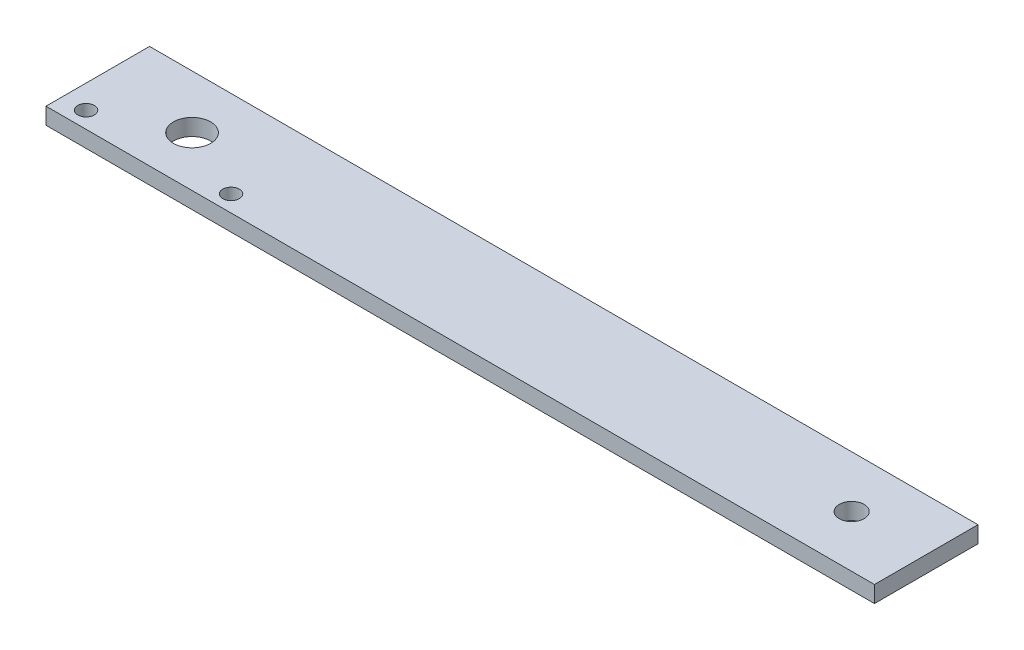
from build123d import *

# Parameters (mm, degrees)
SKETCH1_W           = 200
SKETCH1_H           = 25
SKETCH1_R           = 2
SKETCH1_R_2         = 3
SKETCH1_R_3         = 4.5
BOSS_EXTRUDE1_DEPTH = 4


with BuildPart() as part:
    # Sketch1 → Boss-Extrude1 (new body)
    with BuildSketch(Plane(origin=(0, 0, 0), x_dir=(1, 0, 0), z_dir=(0, 1, 0))):
        Rectangle(SKETCH1_W, SKETCH1_H)
        with Locations((-94.319954605, -8.503918688)):
            Circle(SKETCH1_R, mode=Mode.SUBTRACT)
        with Locations((-59.319954605, -8.503918688)):
            Circle(SKETCH1_R, mode=Mode.SUBTRACT)
        with Locations((82, 0)):
            Circle(SKETCH1_R_2, mode=Mode.SUBTRACT)
        with Locations((-76.841615117, -0.401375252)):
            Circle(SKETCH1_R_3, mode=Mode.SUBTRACT)
    extrude(amount=BOSS_EXTRUDE1_DEPTH)


solid = part.part
